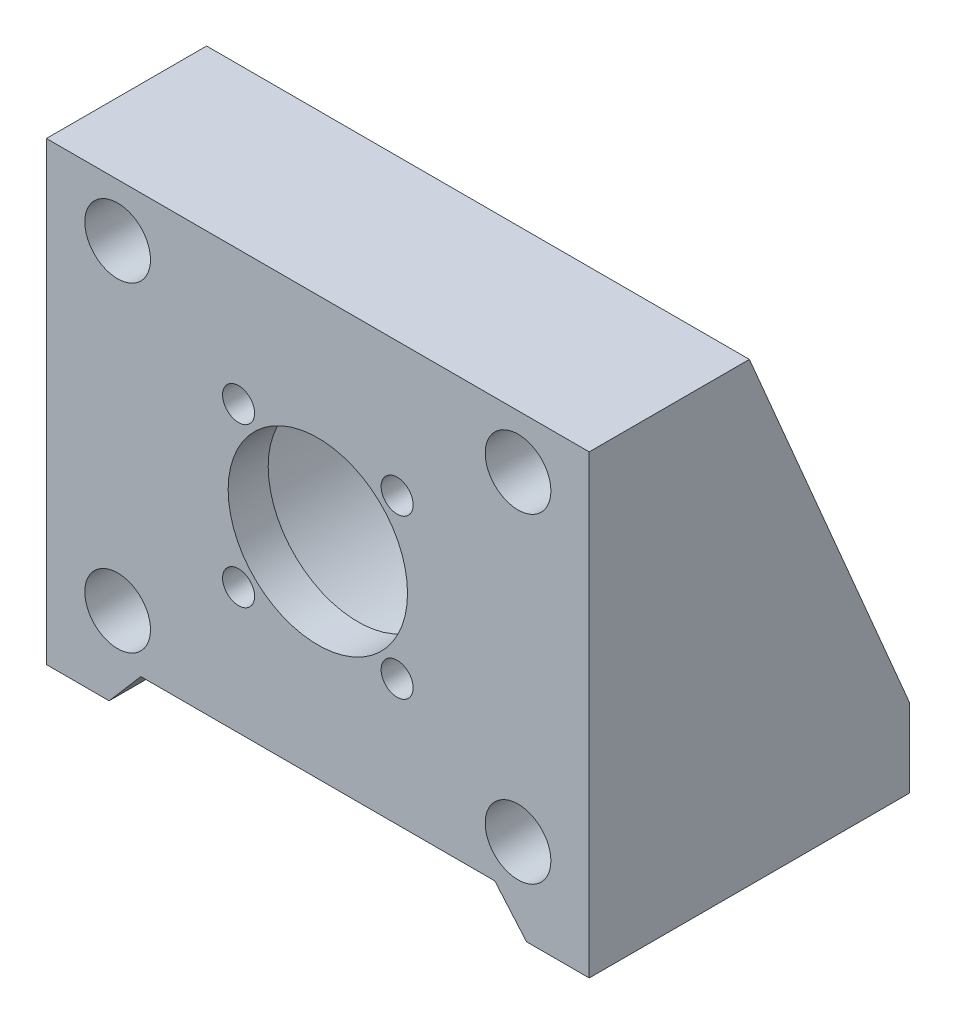
from build123d import *
from build123d.topology import SkipClean

# Parameters (mm, degrees)
SALIENTE_EXTRUIR1_START = -35
SALIENTE_EXTRUIR1_DEPTH = 40
CROQUIS5_R              = 18.1
CORTAR_EXTRUIR1_DEPTH   = 35
CHAFL_N1_SIZE           = 47.117047316
CHAFL_N1_SIZE_2         = 20
TALADRO1_D              = 8.2
TALADRO1_DEPTH          = 15
TALADRO3_D              = 4
MATRIZC2_COUNT          = 4


with BuildPart() as part:
    # Croquis2 → Saliente-Extruir1 (new body)
    with BuildSketch(Plane.XY.offset(SALIENTE_EXTRUIR1_START)):
        with BuildLine():
            Line((0, -11.2), (0, -25.666803753))
            Line((0, -25.666803753), (22.099478046, -25.666803753))
            Line((22.099478046, -25.666803753), (26.062319902, -30.269332556))
            Line((26.062319902, -30.269332556), (33.890912562, -30.269332556))
            Line((33.890912562, -30.269332556), (33.890912562, 26.630335828))
            Line((33.890912562, 26.630335828), (0, 26.630335828))
            Line((0, 26.630335828), (0, 11.2))
            ThreePointArc((0, 11.2), (11.2, 0), (0, -11.2))
        make_face()
    saliente_extruir1 = extrude(amount=SALIENTE_EXTRUIR1_DEPTH)

    # Simetría1: Saliente-Extruir1 across plane
    with SkipClean():  # the faces are left unmerged after this step: merging them gives an invalid solid
        add(saliente_extruir1.mirror(Plane(origin=(0, 0, 0), x_dir=(0, 0, 1), z_dir=(1, 0, 0))))

    # Croquis5 → Cortar-Extruir1 (cut)
    with SkipClean():  # the faces are left unmerged after this step: merging them gives an invalid solid
        with BuildSketch(Plane.XY):
            Circle(CROQUIS5_R)
        extrude(amount=-CORTAR_EXTRUIR1_DEPTH, mode=Mode.SUBTRACT)

    # Chaflán1
    # the kernel refuses this chamfer: 47.117047316, 20 mm, written as the material it takes off along each edge
    with BuildSketch(Plane(origin=(156.034553022, 26.630335828, -35), x_dir=(0, -0.9998864034585262, -0.015072497429863657), z_dir=(-1, 0, 0))) as chafl_n1_piece_1:
        Polygon((CHAFL_N1_SIZE * 0.999886403469, CHAFL_N1_SIZE * 0.01507249743), (-CHAFL_N1_SIZE_2 * 0.0150724974299, CHAFL_N1_SIZE_2 * 0.999886403459), (0, 0), align=None)
    extrude(amount=156.034553022, mode=Mode.SUBTRACT)
    with BuildSketch(Plane(origin=(-156.034553022, 26.630335828, -35), x_dir=(0, -0.9998864034585262, -0.015072497429863657), z_dir=(1, 0, 0))) as chafl_n1_piece_2:
        Polygon((CHAFL_N1_SIZE * 0.999886403469, -CHAFL_N1_SIZE * 0.01507249743), (-CHAFL_N1_SIZE_2 * 0.0150724974299, -CHAFL_N1_SIZE_2 * 0.999886403459), (0, 0), align=None)
    extrude(amount=156.034553022, mode=Mode.SUBTRACT)

    # Taladro1
    with Locations(Plane.XY.offset(5)):
        with Locations((25, -20), (25, 20), (-25, 20), (-25, -20)):
            Hole(TALADRO1_D / 2, depth=TALADRO1_DEPTH)

    # Taladro3 (through all)
    with Locations(Plane.XY.offset(5)):
        with Locations((9.899494937, 9.899494937)):
            taladro3 = Hole(TALADRO3_D / 2)

    # MatrizC2: Taladro3 ×4 about axis
    matrizc2_axis = Axis((0, 0, 0), (0, 0, 1))
    for i in range(1, MATRIZC2_COUNT):
        add(taladro3.rotate(matrizc2_axis, i * 360 / MATRIZC2_COUNT), mode=Mode.SUBTRACT)


solid = part.part
